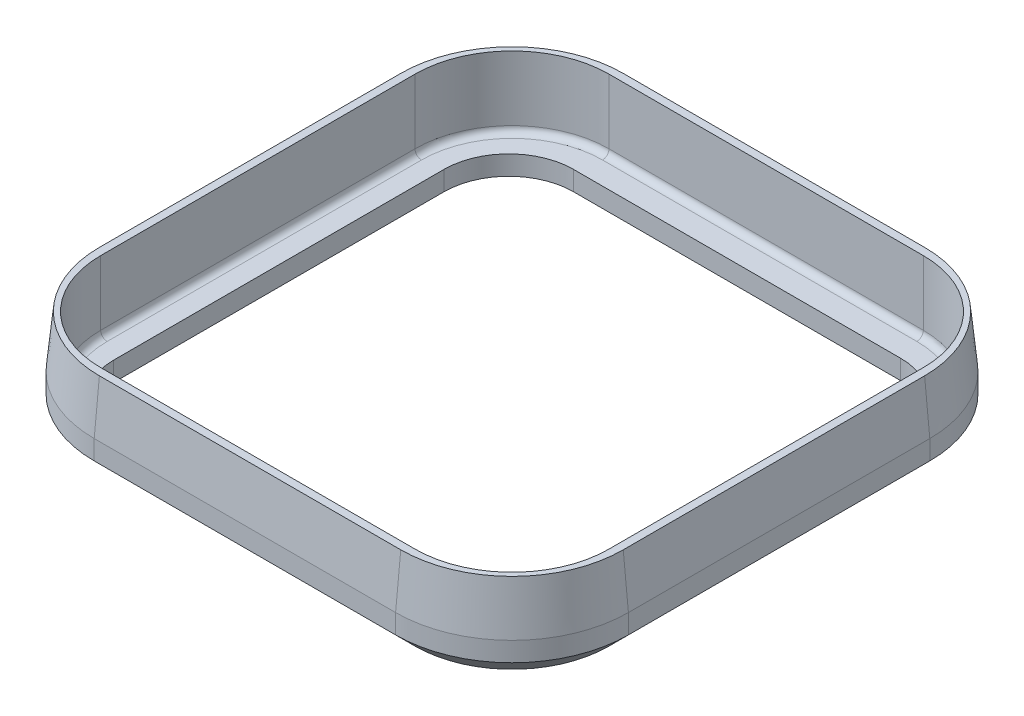
from build123d import *
from OCP.BRepFilletAPI import BRepFilletAPI_MakeChamfer

# Parameters (mm, degrees)
BOSS_EXTRUDE1_DEPTH = 10
BOSS_EXTRUDE2_DEPTH = 2
FILLET1_R           = 1
BOSS_EXTRUDE3_DEPTH = 3
CHAMFER2_SIZE       = 8
CHAMFER2_SIZE2      = 0.8
BOSS_EXTRUDE4_START = -2
BOSS_EXTRUDE4_DEPTH = 2
BOSS_EXTRUDE5_DEPTH = 1
CHAMFER3_SIZE       = 3
SKETCH6_W           = 21.985963637
SKETCH6_H           = 0.240414759
CUT_EXTRUDE1_DEPTH  = 4
CHAMFER4_SIZE       = 2
CHAMFER5_SIZE       = 1.5
CHAMFER6_SIZE       = 1.5


with BuildPart() as part:
    # Sketch1 → Boss-Extrude1 (new body)
    with BuildSketch(Plane(origin=(0, 0, 0), x_dir=(1, 0, 0), z_dir=(0, 1, 0))):
        with BuildLine():
            Line((-27.176063521, 37.707550883), (19.423936479, 37.707550883))
            ThreePointArc((19.423936479, 37.707550883), (32.151858541, 32.435472945), (37.423936479, 19.707550883))
            Line((37.423936479, 19.707550883), (37.423936479, -26.892449117))
            ThreePointArc((37.423936479, -26.892449117), (32.151858541, -39.620371178), (19.423936479, -44.892449117))
            Line((19.423936479, -44.892449117), (-27.176063521, -44.892449117))
            ThreePointArc((-27.176063521, -44.892449117), (-39.903985582, -39.620371178), (-45.176063521, -26.892449117))
            Line((-45.176063521, -26.892449117), (-45.176063521, 19.707550883))
            ThreePointArc((-45.176063521, 19.707550883), (-39.903985582, 32.435472945), (-27.176063521, 37.707550883))
        make_face()
        with BuildLine():
            ThreePointArc((-28.176063521, 35.707550883), (-38.782665238, 31.314152601), (-43.176063521, 20.707550883))
            Line((-43.176063521, 20.707550883), (-43.176063521, -27.892449117))
            ThreePointArc((-43.176063521, -27.892449117), (-38.782665238, -38.499050834), (-28.176063521, -42.892449117))
            Line((-28.176063521, -42.892449117), (20.423936479, -42.892449117))
            ThreePointArc((20.423936479, -42.892449117), (31.030538197, -38.499050834), (35.423936479, -27.892449117))
            Line((35.423936479, -27.892449117), (35.423936479, 20.707550883))
            ThreePointArc((35.423936479, 20.707550883), (31.030538197, 31.314152601), (20.423936479, 35.707550883))
            Line((20.423936479, 35.707550883), (-28.176063521, 35.707550883))
        make_face(mode=Mode.SUBTRACT)
    extrude(amount=BOSS_EXTRUDE1_DEPTH)

    # Sketch1<3> → Boss-Extrude2 (add)
    with BuildSketch(Plane(origin=(0, 0, 0), x_dir=(1, 0, 0), z_dir=(0, 1, 0))):
        with BuildLine():
            Line((-28.176063521, 35.707550883), (20.423936479, 35.707550883))
            ThreePointArc((20.423936479, 35.707550883), (31.030538197, 31.314152601), (35.423936479, 20.707550883))
            Line((35.423936479, 20.707550883), (35.423936479, -27.892449117))
            ThreePointArc((35.423936479, -27.892449117), (31.030538197, -38.499050834), (20.423936479, -42.892449117))
            Line((20.423936479, -42.892449117), (-28.176063521, -42.892449117))
            ThreePointArc((-28.176063521, -42.892449117), (-38.782665238, -38.499050834), (-43.176063521, -27.892449117))
            Line((-43.176063521, -27.892449117), (-43.176063521, 20.707550883))
            ThreePointArc((-43.176063521, 20.707550883), (-38.782665238, 31.314152601), (-28.176063521, 35.707550883))
        make_face()
        with BuildLine():
            ThreePointArc((-30.176063521, 33.707550883), (-37.954238114, 30.485725476), (-41.176063521, 22.707550883))
            Line((-41.176063521, 22.707550883), (-41.176063521, -29.892449117))
            ThreePointArc((-41.176063521, -29.892449117), (-37.954238114, -37.67062371), (-30.176063521, -40.892449117))
            Line((-30.176063521, -40.892449117), (22.423936479, -40.892449117))
            ThreePointArc((22.423936479, -40.892449117), (30.202111072, -37.67062371), (33.423936479, -29.892449117))
            Line((33.423936479, -29.892449117), (33.423936479, 22.707550883))
            ThreePointArc((33.423936479, 22.707550883), (30.202111072, 30.485725476), (22.423936479, 33.707550883))
            Line((22.423936479, 33.707550883), (-30.176063521, 33.707550883))
        make_face(mode=Mode.SUBTRACT)
    extrude(amount=BOSS_EXTRUDE2_DEPTH)

    # Fillet1
    fillet1_edges = [part.edges().sort_by_distance(p)[0] for p in [
        (-3.876063521, 2, -35.707550883),
        (35.423936479, 2, 3.592449117),
        (31.030538197, 2, -31.314152601),
        (-38.782665238, 2, -31.314152601),
        (-43.176063521, 2, 3.592449117),
        (-38.782665238, 2, 38.499050834),
        (-3.876063521, 2, 42.892449117),
        (31.030538197, 2, 38.499050834),
    ]]
    fillet(fillet1_edges, radius=FILLET1_R)

    # Sketch2 → Boss-Extrude3 (add)
    with BuildSketch(Plane(origin=(0, 10, 0), x_dir=(1, 0, 0), z_dir=(0, 1, 0))):
        with BuildLine():
            Line((19.423936479, 37.707550883), (-27.176063521, 37.707550883))
            ThreePointArc((-27.176063521, 37.707550883), (-39.903985582, 32.435472945), (-45.176063521, 19.707550883))
            Line((-45.176063521, 19.707550883), (-45.176063521, -26.892449117))
            ThreePointArc((-45.176063521, -26.892449117), (-39.903985582, -39.620371178), (-27.176063521, -44.892449117))
            Line((-27.176063521, -44.892449117), (19.423936479, -44.892449117))
            ThreePointArc((19.423936479, -44.892449117), (32.151858541, -39.620371178), (37.423936479, -26.892449117))
            Line((37.423936479, -26.892449117), (37.423936479, 19.707550883))
            ThreePointArc((37.423936479, 19.707550883), (32.151858541, 32.435472945), (19.423936479, 37.707550883))
        make_face()
        with BuildLine():
            Line((-28.176063521, 35.707550883), (20.423936479, 35.707550883))
            ThreePointArc((20.423936479, 35.707550883), (31.030538197, 31.314152601), (35.423936479, 20.707550883))
            Line((35.423936479, 20.707550883), (35.423936479, -27.892449117))
            ThreePointArc((35.423936479, -27.892449117), (31.030538197, -38.499050834), (20.423936479, -42.892449117))
            Line((20.423936479, -42.892449117), (-28.176063521, -42.892449117))
            ThreePointArc((-28.176063521, -42.892449117), (-38.782665238, -38.499050834), (-43.176063521, -27.892449117))
            Line((-43.176063521, -27.892449117), (-43.176063521, 20.707550883))
            ThreePointArc((-43.176063521, 20.707550883), (-38.782665238, 31.314152601), (-28.176063521, 35.707550883))
        make_face(mode=Mode.SUBTRACT)
    extrude(amount=BOSS_EXTRUDE3_DEPTH)

    # Chamfer2: one chamfer whose edges measure the first distance from different faces: ONE call of the kernel's chamfer builder (chamfer() names one face for all edges)
    chamfer2_edges_1 = [part.edges().sort_by_distance(p)[0] for p in [
        (32.151858541, 13, -32.435472945),
    ]]
    chamfer2_side_1 = [part.faces().sort_by_distance(p)[0] for p in [
        (32.151858541, 6.5, -32.435472945),
    ]]
    chamfer2_edges_2 = [part.edges().sort_by_distance(p)[0] for p in [
        (-3.876063521, 13, -37.707550883),
    ]]
    chamfer2_side_2 = [part.faces().sort_by_distance(p)[0] for p in [
        (-3.876063521, 6.5, -37.707550883),
    ]]
    chamfer2_edges_3 = [part.edges().sort_by_distance(p)[0] for p in [
        (-39.903985582, 13, -32.435472945),
    ]]
    chamfer2_side_3 = [part.faces().sort_by_distance(p)[0] for p in [
        (-39.903985582, 6.5, -32.435472945),
    ]]
    chamfer2_edges_4 = [part.edges().sort_by_distance(p)[0] for p in [
        (-45.176063521, 13, 3.592449117),
    ]]
    chamfer2_side_4 = [part.faces().sort_by_distance(p)[0] for p in [
        (-45.176063521, 6.5, 3.592449117),
    ]]
    chamfer2_edges_5 = [part.edges().sort_by_distance(p)[0] for p in [
        (-39.903985582, 13, 39.620371178),
    ]]
    chamfer2_side_5 = [part.faces().sort_by_distance(p)[0] for p in [
        (-39.903985582, 6.5, 39.620371178),
    ]]
    chamfer2_edges_6 = [part.edges().sort_by_distance(p)[0] for p in [
        (-3.876063521, 13, 44.892449117),
    ]]
    chamfer2_side_6 = [part.faces().sort_by_distance(p)[0] for p in [
        (-3.876063521, 6.5, 44.892449117),
    ]]
    chamfer2_edges_7 = [part.edges().sort_by_distance(p)[0] for p in [
        (32.151858541, 13, 39.620371178),
    ]]
    chamfer2_side_7 = [part.faces().sort_by_distance(p)[0] for p in [
        (32.151858541, 6.5, 39.620371178),
    ]]
    chamfer2_edges_8 = [part.edges().sort_by_distance(p)[0] for p in [
        (37.423936479, 13, 3.592449117),
    ]]
    chamfer2_side_8 = [part.faces().sort_by_distance(p)[0] for p in [
        (37.423936479, 6.5, 3.592449117),
    ]]
    chamfer2 = BRepFilletAPI_MakeChamfer(part.part.solid().wrapped)
    for e in chamfer2_edges_1:
        chamfer2.Add(CHAMFER2_SIZE, CHAMFER2_SIZE2, e.wrapped, chamfer2_side_1[0].wrapped)  # the first distance lies on this face
    for e in chamfer2_edges_2:
        chamfer2.Add(CHAMFER2_SIZE, CHAMFER2_SIZE2, e.wrapped, chamfer2_side_2[0].wrapped)  # the first distance lies on this face
    for e in chamfer2_edges_3:
        chamfer2.Add(CHAMFER2_SIZE, CHAMFER2_SIZE2, e.wrapped, chamfer2_side_3[0].wrapped)  # the first distance lies on this face
    for e in chamfer2_edges_4:
        chamfer2.Add(CHAMFER2_SIZE, CHAMFER2_SIZE2, e.wrapped, chamfer2_side_4[0].wrapped)  # the first distance lies on this face
    for e in chamfer2_edges_5:
        chamfer2.Add(CHAMFER2_SIZE, CHAMFER2_SIZE2, e.wrapped, chamfer2_side_5[0].wrapped)  # the first distance lies on this face
    for e in chamfer2_edges_6:
        chamfer2.Add(CHAMFER2_SIZE, CHAMFER2_SIZE2, e.wrapped, chamfer2_side_6[0].wrapped)  # the first distance lies on this face
    for e in chamfer2_edges_7:
        chamfer2.Add(CHAMFER2_SIZE, CHAMFER2_SIZE2, e.wrapped, chamfer2_side_7[0].wrapped)  # the first distance lies on this face
    for e in chamfer2_edges_8:
        chamfer2.Add(CHAMFER2_SIZE, CHAMFER2_SIZE2, e.wrapped, chamfer2_side_8[0].wrapped)  # the first distance lies on this face
    add(Compound.cast(chamfer2.Shape()), mode=Mode.REPLACE)

    # Sketch3 → Boss-Extrude4 (add)
    with BuildSketch(Plane.XZ.offset(BOSS_EXTRUDE4_START)):
        with BuildLine():
            Line((-30.176063521, -33.707550883), (22.423936479, -33.707550883))
            ThreePointArc((22.423936479, -33.707550883), (30.202111072, -30.485725476), (33.423936479, -22.707550883))
            Line((33.423936479, -22.707550883), (33.423936479, 29.892449117))
            ThreePointArc((33.423936479, 29.892449117), (30.202111072, 37.67062371), (22.423936479, 40.892449117))
            Line((22.423936479, 40.892449117), (-30.176063521, 40.892449117))
            ThreePointArc((-30.176063521, 40.892449117), (-37.954238114, 37.67062371), (-41.176063521, 29.892449117))
            Line((-41.176063521, 29.892449117), (-41.176063521, -22.707550883))
            ThreePointArc((-41.176063521, -22.707550883), (-37.954238114, -30.485725476), (-30.176063521, -33.707550883))
        make_face()
        with BuildLine():
            Line((-29.176063521, -31.207550883), (21.423936479, -31.207550883))
            ThreePointArc((21.423936479, -31.207550883), (28.495004291, -28.278618695), (31.423936479, -21.207550883))
            Line((31.423936479, -21.207550883), (31.423936479, 29.892449117))
            ThreePointArc((31.423936479, 29.892449117), (28.495004291, 36.963516928), (21.423936479, 39.892449117))
            Line((21.423936479, 39.892449117), (-29.176063521, 39.892449117))
            ThreePointArc((-29.176063521, 39.892449117), (-36.247131332, 36.963516928), (-39.176063521, 29.892449117))
            Line((-39.176063521, 29.892449117), (-39.176063521, -21.207550883))
            ThreePointArc((-39.176063521, -21.207550883), (-36.247131332, -28.278618695), (-29.176063521, -31.207550883))
        make_face(mode=Mode.SUBTRACT)
    extrude(amount=BOSS_EXTRUDE4_DEPTH)

    # Sketch5 → Boss-Extrude5 (add)
    with BuildSketch(Plane.XZ):
        with BuildLine():
            Line((-27.176063521, -37.707550883), (19.423936479, -37.707550883))
            ThreePointArc((19.423936479, -37.707550883), (32.151858541, -32.435472945), (37.423936479, -19.707550883))
            Line((37.423936479, -19.707550883), (37.423936479, 26.892449117))
            ThreePointArc((37.423936479, 26.892449117), (32.151858541, 39.620371178), (19.423936479, 44.892449117))
            Line((19.423936479, 44.892449117), (-27.176063521, 44.892449117))
            ThreePointArc((-27.176063521, 44.892449117), (-39.903985582, 39.620371178), (-45.176063521, 26.892449117))
            Line((-45.176063521, 26.892449117), (-45.176063521, -19.707550883))
            ThreePointArc((-45.176063521, -19.707550883), (-39.903985582, -32.435472945), (-27.176063521, -37.707550883))
        make_face()
        with BuildLine():
            Line((-39.176063521, 29.892449117), (-39.176063521, -21.207550883))
            ThreePointArc((-39.176063521, -21.207550883), (-36.247131332, -28.278618695), (-29.176063521, -31.207550883))
            Line((-29.176063521, -31.207550883), (21.423936479, -31.207550883))
            ThreePointArc((21.423936479, -31.207550883), (28.495004291, -28.278618695), (31.423936479, -21.207550883))
            Line((31.423936479, -21.207550883), (31.423936479, 29.892449117))
            ThreePointArc((31.423936479, 29.892449117), (28.495004291, 36.963516928), (21.423936479, 39.892449117))
            Line((21.423936479, 39.892449117), (-29.176063521, 39.892449117))
            ThreePointArc((-29.176063521, 39.892449117), (-36.247131332, 36.963516928), (-39.176063521, 29.892449117))
        make_face(mode=Mode.SUBTRACT)
    extrude(amount=BOSS_EXTRUDE5_DEPTH)

    # Chamfer3
    chamfer3_edges = [part.edges().sort_by_distance(p)[0] for p in [
        (-39.903985582, -1, -32.435472945),
        (-3.876063521, -1, -37.707550883),
        (32.151858541, -1, -32.435472945),
        (37.423936479, -1, 3.592449117),
        (32.151858541, -1, 39.620371178),
        (-3.876063521, -1, 44.892449117),
        (-39.903985582, -1, 39.620371178),
        (-45.176063521, -1, 3.592449117),
    ]]
    chamfer(chamfer3_edges, length=CHAMFER3_SIZE)

    # Sketch6 → Cut-Extrude1 (cut)
    with BuildSketch(Plane.XZ.offset(1)):
        with Locations((-3.812767506, 39.996881837)):
            Rectangle(SKETCH6_W, SKETCH6_H)
    extrude(amount=-CUT_EXTRUDE1_DEPTH, mode=Mode.SUBTRACT)

    # Chamfer4
    # the kernel refuses this chamfer: 2 mm, written as the material it takes off along each edge
    with BuildSketch(Plane(origin=(7.180214313, -1, 40.117089217), x_dir=(0, -0.027495876610586403, 0.9996219169112968), z_dir=(-1, 0, 0))) as chamfer4_piece_1:
        Polygon((CHAMFER4_SIZE * 0.999621916911, CHAMFER4_SIZE * 0.0274958766106), (-CHAMFER4_SIZE * 0.0274958766106, CHAMFER4_SIZE * 0.999621916911), (0, 0), align=None)
    extrude(amount=21.985963637, mode=Mode.SUBTRACT)

    # Chamfer5
    chamfer5_edges = [part.edges().sort_by_distance(p)[0] for p in [
        (7.180214313, -1, 40.892449117),
    ]]
    chamfer(chamfer5_edges, length=CHAMFER5_SIZE)

    # Chamfer6
    chamfer6_edges = [part.edges().sort_by_distance(p)[0] for p in [
        (-14.805749324, -1, 40.892449117),
    ]]
    chamfer(chamfer6_edges, length=CHAMFER6_SIZE)


solid = part.part
